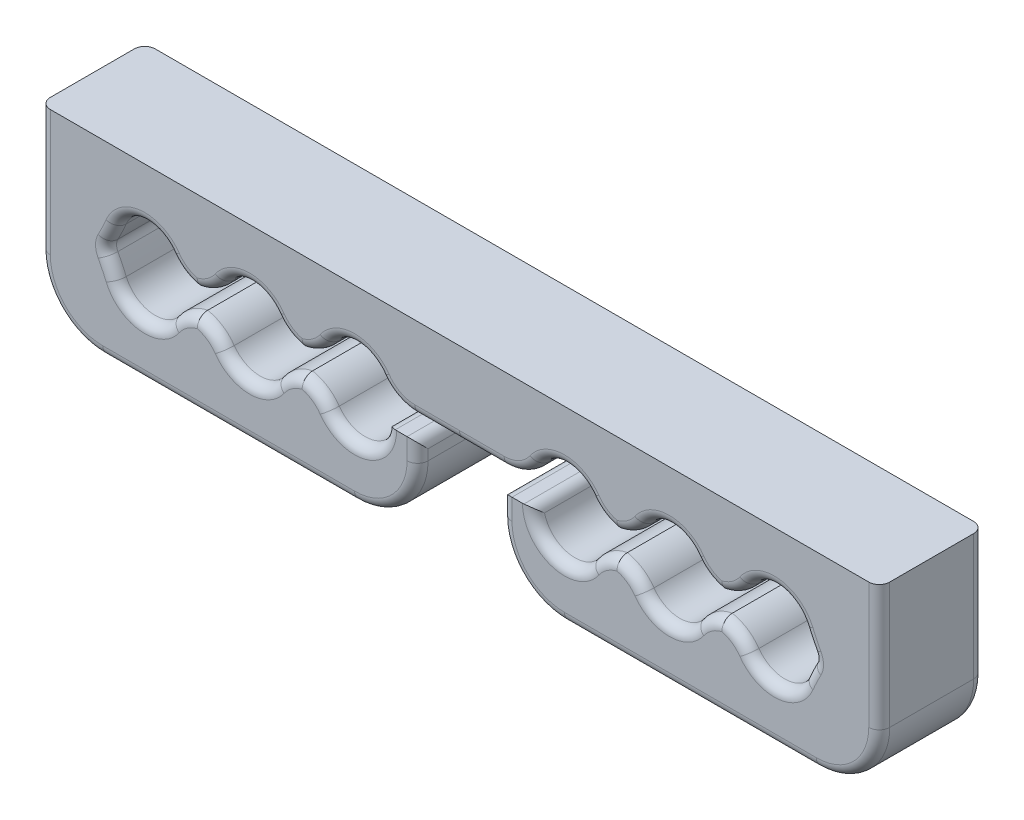
from build123d import *

# Parameters (mm, degrees)
BOSS_EXTRUDE1_DEPTH  = 2.5
FILLET1_R            = 10
FILLET2_R            = 2
FILLET3_R            = 3
FILLET4_R            = 0.5
FILLET1_OF_MIRROR1_R = 10
FILLET2_OF_MIRROR1_R = 2
FILLET3_OF_MIRROR1_R = 3
FILLET4_OF_MIRROR1_R = 0.5


with BuildPart() as part:
    # Sketch3 → Boss-Extrude1 (new, symmetric)
    with BuildSketch(Plane.XY):
        with BuildLine():
            Line((-20, 0), (-20, -4))
            Line((-20, -4), (-2, -4))
            Line((-2, -4), (-2, 0))
            Line((-2, 0), (-3.5, 0))
            ThreePointArc((-3.5, 0), (-5, -1.5), (-6.5, 0))
            Line((-6.5, 0), (-8.5, 0))
            ThreePointArc((-8.5, 0), (-10, -1.5), (-11.5, 0))
            Line((-11.5, 0), (-13.5, 0))
            ThreePointArc((-13.5, 0), (-15, -1.5), (-16.5, 0))
            ThreePointArc((-16.5, 0), (-16.844061217, 0.5), (-16.5, 1))
            ThreePointArc((-16.5, 1), (-15, 2.5), (-13.5, 1))
            Line((-13.5, 1), (-11.5, 1))
            ThreePointArc((-11.5, 1), (-10, 2.5), (-8.5, 1))
            Line((-8.5, 1), (-6.5, 1))
            ThreePointArc((-6.5, 1), (-5, 2.5), (-3.5, 1))
            Line((-3.5, 1), (-2, 1))
            Line((-2, 1), (0, 1))
            Line((0, 1), (0, 5))
            Line((0, 5), (-2, 5))
            Line((-2, 5), (-20, 5))
            Line((-20, 5), (-20, 1))
            Line((-20, 1), (-20, 0))
        make_face()
    boss_extrude1 = extrude(amount=BOSS_EXTRUDE1_DEPTH, both=True)

    # Fillet1
    fillet1_edges = [part.edges().sort_by_distance(p)[0] for p in [
        (-16.5, 1, 0),
        (-16.5, 0, 0),
    ]]
    fillet(fillet1_edges, radius=FILLET1_R)

    # Fillet2
    # the kernel refuses this fillet: 2 mm, written as the material it takes off along each edge
    with BuildSketch(Plane(origin=(-13.5, 1, -5.930703308), x_dir=(-0.29945633517394393, 0.9541100058820212, 0), z_dir=(0, 0, 1))) as fillet2_piece_1:
        with BuildLine():
            CenterArc((1.497281676, -1.908220012), FILLET2_R, 107.42495229, 55.150095421)
            Line((-0.410938336, -1.309307341), (0, 0))
            ThreePointArc((0, 0), (0.449184503, -0.068834991), (0.898369006, 0))
        make_face()
    extrude(amount=11.861406616, mode=Mode.SUBTRACT)
    with BuildSketch(Plane(origin=(-11.5, 1, -5.930703308), x_dir=(-1, 0, 0), z_dir=(0, 0, 1))) as fillet2_piece_2:
        with BuildLine():
            CenterArc((1.372281323, -2), FILLET2_R, 90, 55.150095421)
            ThreePointArc((-0.26902229, -0.857142857), (-0.068834991, -0.449184503), (0, 0))
            Line((0, 0), (1.372281323, 0))
        make_face()
    extrude(amount=11.861406616, mode=Mode.SUBTRACT)
    with BuildSketch(Plane(origin=(-8.5, 1, 5.930703308), x_dir=(-0.29945633517396103, 0.9541100058820159, 0), z_dir=(0, 0, -1)), Plane(origin=(-3.5, 1, 5.930703308), x_dir=(-0.2994563351739779, 0.9541100058820106, 0), z_dir=(0, 0, -1)), Plane(origin=(-8.5, 0, -5.930703308), x_dir=(-0.29945633517396103, -0.9541100058820159, 0), z_dir=(0, 0, 1)), Plane(origin=(-13.5, 0, -5.930703308), x_dir=(-0.2994563351739456, -0.9541100058820208, 0), z_dir=(0, 0, 1))) as fillet2_piece_3:
        with BuildLine():
            CenterArc((1.497281676, 1.908220012), FILLET2_R, 197.42495229, 55.150095421)
            Line((-0.410938336, 1.309307341), (0, 0))
            ThreePointArc((0, 0), (0.449184503, 0.068834991), (0.898369006, 0))
        make_face()
    extrude(amount=11.861406616, mode=Mode.SUBTRACT)
    with BuildSketch(Plane(origin=(-6.5, 1, 5.930703308), x_dir=(-1, 0, 0), z_dir=(0, 0, -1)), Plane(origin=(-6.5, 0, -5.930703308), x_dir=(-1, 0, 0), z_dir=(0, 0, 1)), Plane(origin=(-11.5, 0, -5.930703308), x_dir=(-1, 0, 0), z_dir=(0, 0, 1))) as fillet2_piece_4:
        with BuildLine():
            CenterArc((1.372281323, 2), FILLET2_R, 214.849904579, 55.150095421)
            ThreePointArc((-0.26902229, 0.857142857), (-0.068834991, 0.449184503), (0, 0))
            Line((0, 0), (1.372281323, 0))
        make_face()
    extrude(amount=11.861406616, mode=Mode.SUBTRACT)

    # Fillet3
    fillet3_edges = [part.edges().sort_by_distance(p)[0] for p in [
        (-2, -4, 0),
        (-20, -4, 0),
    ]]
    fillet(fillet3_edges, radius=FILLET3_R)

    # Fillet4
    fillet4_edges = [part.edges().sort_by_distance(p)[0] for p in [
        (-2, -0.5, -2.5),
        (-2, -0.5, 2.5),
        (-11, -4, -2.5),
        (-19.121320344, -3.121320344, -2.5),
        (-2.878679656, -3.121320344, -2.5),
        (-11, -4, 2.5),
        (-19.121320344, -3.121320344, 2.5),
        (-2.878679656, -3.121320344, 2.5),
        (-20, 2, -2.5),
        (-4.550815497, -1.431165009, 2.5),
        (-4.550815497, -1.431165009, -2.5),
        (-3.5, 0, 0),
        (-2, 0, 0),
        (-20, 2, 2.5),
        (-15.155006773, 2.49196947, -2.5),
        (-15.155006773, 2.49196947, 2.5),
        (-16.844061217, 0.5, -2.5),
        (-16.570926413, -0.165089198, -2.5),
        (-16.570926413, 1.165089198, -2.5),
        (-16.844061217, 0.5, 2.5),
        (-16.570926413, -0.165089198, 2.5),
        (-16.570926413, 1.165089198, 2.5),
        (-15.155006773, -1.49196947, -2.5),
        (-10, -1.5, -2.5),
        (-1.063859338, 1, -2.5),
        (-5, 2.5, -2.5),
        (-10, 2.5, -2.5),
        (-13.215206511, -0.321497629, -2.5),
        (-11.784793489, -0.321497629, -2.5),
        (-8.215206511, -0.321497629, -2.5),
        (-6.784793489, -0.321497629, -2.5),
        (-3.053538777, 1.227189479, -2.5),
        (-6.784793489, 1.321497629, -2.5),
        (-8.215206511, 1.321497629, -2.5),
        (-11.784793489, 1.321497629, -2.5),
        (-13.215206511, 1.321497629, -2.5),
        (-10, 2.5, 2.5),
        (-5, 2.5, 2.5),
        (-1.063859338, 1, 2.5),
        (-10, -1.5, 2.5),
        (-15.155006773, -1.49196947, 2.5),
        (-13.215206511, -0.321497629, 2.5),
        (-11.784793489, -0.321497629, 2.5),
        (-8.215206511, -0.321497629, 2.5),
        (-6.784793489, -0.321497629, 2.5),
        (-3.053538777, 1.227189479, 2.5),
        (-6.784793489, 1.321497629, 2.5),
        (-8.215206511, 1.321497629, 2.5),
        (-11.784793489, 1.321497629, 2.5),
        (-13.215206511, 1.321497629, 2.5),
    ]]
    fillet(fillet4_edges, radius=FILLET4_R)

    # Mirror1: Boss-Extrude1 across plane
    add(boss_extrude1.mirror(Plane(origin=(0, 0, 0), x_dir=(0, 0, 1), z_dir=(1, 0, 0))))

    # Fillet1 of Mirror1
    fillet1_of_mirror1_edges = [part.edges().sort_by_distance(p)[0] for p in [
        (16.5, 1, 0),
        (16.5, 0, 0),
    ]]
    fillet(fillet1_of_mirror1_edges, radius=FILLET1_OF_MIRROR1_R)

    # Fillet2 of Mirror1
    # the kernel refuses this fillet: 2 mm, written as the material it takes off along each edge
    with BuildSketch(Plane(origin=(13.5, 1, -5.930703308), x_dir=(0.29945633517394393, 0.9541100058820212, 0), z_dir=(0, 0, 1))) as fillet2_of_mirror1_piece_1:
        with BuildLine():
            CenterArc((1.497281676, 1.908220012), FILLET2_OF_MIRROR1_R, 197.42495229, 55.150095421)
            Line((-0.410938336, 1.309307341), (0, 0))
            ThreePointArc((0, 0), (0.449184503, 0.068834991), (0.898369006, 0))
        make_face()
    extrude(amount=11.861406616, mode=Mode.SUBTRACT)
    with BuildSketch(Plane(origin=(11.5, 1, -5.930703308), x_dir=(1, 0, 0), z_dir=(0, 0, 1))) as fillet2_of_mirror1_piece_2:
        with BuildLine():
            CenterArc((1.372281323, 2), FILLET2_OF_MIRROR1_R, 214.849904579, 55.150095421)
            ThreePointArc((-0.26902229, 0.857142857), (-0.068834991, 0.449184503), (0, 0))
            Line((0, 0), (1.372281323, 0))
        make_face()
    extrude(amount=11.861406616, mode=Mode.SUBTRACT)
    with BuildSketch(Plane(origin=(8.5, 1, 5.930703308), x_dir=(0.29945633517396103, 0.9541100058820159, 0), z_dir=(0, 0, -1)), Plane(origin=(3.5, 1, 5.930703308), x_dir=(0.2994563351739779, 0.9541100058820106, 0), z_dir=(0, 0, -1)), Plane(origin=(8.5, 0, -5.930703308), x_dir=(0.29945633517396103, -0.9541100058820159, 0), z_dir=(0, 0, 1)), Plane(origin=(13.5, 0, -5.930703308), x_dir=(0.2994563351739456, -0.9541100058820208, 0), z_dir=(0, 0, 1))) as fillet2_of_mirror1_piece_3:
        with BuildLine():
            CenterArc((1.497281676, -1.908220012), FILLET2_OF_MIRROR1_R, 107.42495229, 55.150095421)
            Line((-0.410938336, -1.309307341), (0, 0))
            ThreePointArc((0, 0), (0.449184503, -0.068834991), (0.898369006, 0))
        make_face()
    extrude(amount=11.861406616, mode=Mode.SUBTRACT)
    with BuildSketch(Plane(origin=(6.5, 1, 5.930703308), x_dir=(1, 0, 0), z_dir=(0, 0, -1)), Plane(origin=(6.5, 0, -5.930703308), x_dir=(1, 0, 0), z_dir=(0, 0, 1)), Plane(origin=(11.5, 0, -5.930703308), x_dir=(1, 0, 0), z_dir=(0, 0, 1))) as fillet2_of_mirror1_piece_4:
        with BuildLine():
            CenterArc((1.372281323, -2), FILLET2_OF_MIRROR1_R, 90, 55.150095421)
            ThreePointArc((-0.26902229, -0.857142857), (-0.068834991, -0.449184503), (0, 0))
            Line((0, 0), (1.372281323, 0))
        make_face()
    extrude(amount=11.861406616, mode=Mode.SUBTRACT)

    # Fillet3 of Mirror1
    fillet3_of_mirror1_edges = [part.edges().sort_by_distance(p)[0] for p in [
        (2, -4, 0),
        (20, -4, 0),
    ]]
    fillet(fillet3_of_mirror1_edges, radius=FILLET3_OF_MIRROR1_R)

    # Fillet4 of Mirror1
    fillet4_of_mirror1_edges = [part.edges().sort_by_distance(p)[0] for p in [
        (2, -0.5, -2.5),
        (2, -0.5, 2.5),
        (11, -4, -2.5),
        (19.121320344, -3.121320344, -2.5),
        (2.878679656, -3.121320344, -2.5),
        (11, -4, 2.5),
        (19.121320344, -3.121320344, 2.5),
        (2.878679656, -3.121320344, 2.5),
        (20, 2, -2.5),
        (4.550815497, -1.431165009, 2.5),
        (4.550815497, -1.431165009, -2.5),
        (3.5, 0, 0),
        (2, 0, 0),
        (20, 2, 2.5),
        (15.155006773, 2.49196947, -2.5),
        (15.155006773, 2.49196947, 2.5),
        (16.844061217, 0.5, -2.5),
        (16.570926413, -0.165089198, -2.5),
        (16.570926413, 1.165089198, -2.5),
        (16.844061217, 0.5, 2.5),
        (16.570926413, -0.165089198, 2.5),
        (16.570926413, 1.165089198, 2.5),
        (15.155006773, -1.49196947, -2.5),
        (10, -1.5, -2.5),
        (1.063859338, 1, -2.5),
        (5, 2.5, -2.5),
        (10, 2.5, -2.5),
        (13.215206511, -0.321497629, -2.5),
        (11.784793489, -0.321497629, -2.5),
        (8.215206511, -0.321497629, -2.5),
        (6.784793489, -0.321497629, -2.5),
        (3.053538777, 1.227189479, -2.5),
        (6.784793489, 1.321497629, -2.5),
        (8.215206511, 1.321497629, -2.5),
        (11.784793489, 1.321497629, -2.5),
        (13.215206511, 1.321497629, -2.5),
        (10, 2.5, 2.5),
        (5, 2.5, 2.5),
        (1.063859338, 1, 2.5),
        (10, -1.5, 2.5),
        (15.155006773, -1.49196947, 2.5),
        (13.215206511, -0.321497629, 2.5),
        (11.784793489, -0.321497629, 2.5),
        (8.215206511, -0.321497629, 2.5),
        (6.784793489, -0.321497629, 2.5),
        (3.053538777, 1.227189479, 2.5),
        (6.784793489, 1.321497629, 2.5),
        (8.215206511, 1.321497629, 2.5),
        (11.784793489, 1.321497629, 2.5),
        (13.215206511, 1.321497629, 2.5),
    ]]
    fillet(fillet4_of_mirror1_edges, radius=FILLET4_OF_MIRROR1_R)


solid = part.part
